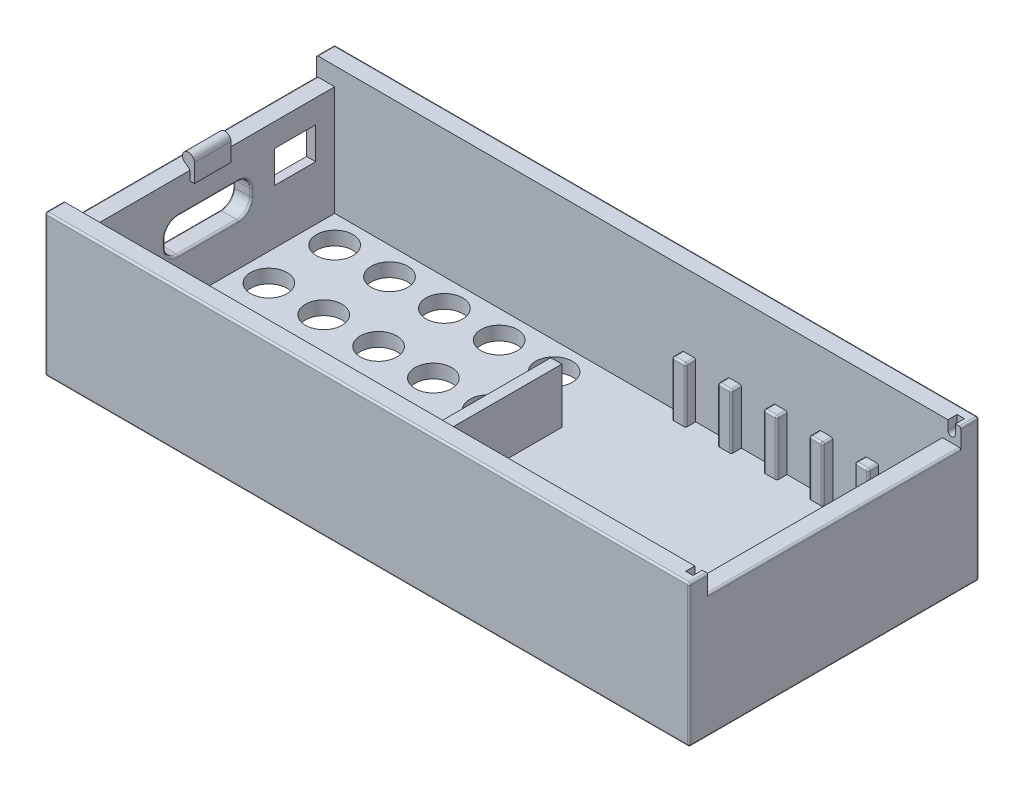
from build123d import *

# Parameters (mm, degrees)
EXTRUDE_1_DEPTH     = 31.7
SKETCH_3_W          = 66.5
SKETCH_3_H          = 2
EXTRUDE_2_DEPTH     = 12
SKETCH_4_W          = 66.5
SKETCH_4_H          = 2
EXTRUDE_3_DEPTH     = 12
SKETCH_5_W          = 1.2
SKETCH_5_H          = 12
EXTRUDE_4_DEPTH     = 6
CUT_EXTRUDE_3_REACH = 80.469
SKETCH_10_W         = 4.5
SKETCH_10_H         = 3.5
CUT_EXTRUDE_4_REACH = 80.469
SKETCH_14_W         = 1.5
SKETCH_14_H         = 6
EXTRUDE_7_DEPTH     = 1.1
FILLET_5_R          = 0.2
FILLET_6_R          = 0.2
SKETCH_15_W         = 1.5
SKETCH_15_H         = 6
EXTRUDE_8_DEPTH     = 1.1
FILLET_7_R          = 0.2
SKETCH_16_W         = 2
SKETCH_16_H         = 2
EXTRUDE_9_DEPTH     = 70.5
FILLET_8_R          = 0.2
FILLET_9_R          = 0.2
FILLET_10_R         = 0.2
FILLET_11_R         = 0.2
SKETCH_17_W         = 6.5
SKETCH_17_H         = 5.5
CUT_EXTRUDE_5_DEPTH = 1
CHAMFER_1_SIZE      = 0.5
SKETCH_18_R         = 2
CUT_EXTRUDE_6_DEPTH = 79.556603796
CUT_EXTRUDE_7_DEPTH = 1
CUT_EXTRUDE_START   = -1
CUT_EXTRUDE_8_DEPTH = 1
EXTRUDE_10_DEPTH    = 2
FILLET_13_R         = 1


with BuildPart() as part:
    # 草图1 → 凸台-拉伸1 (new body)
    with BuildSketch(Plane.XY):
        Polygon((0, 0), (70.5, 0), (70.5, 13.5), (68.5, 13.5), (68.5, 1.5), (2, 1.5), (2, 13.5), (0, 13.5), align=None)
    extrude(amount=EXTRUDE_1_DEPTH)

    # 草图3 → 凸台-拉伸2 (add, through all)
    with BuildSketch(Plane(origin=(0, 1.5, 0), x_dir=(1, 0, 0), z_dir=(0, 1, 0))):
        with Locations((35.25, -30.7)):
            Rectangle(SKETCH_3_W, SKETCH_3_H)
    extrude(amount=EXTRUDE_2_DEPTH)

    # 草图4 → 凸台-拉伸3 (add, through all)
    with BuildSketch(Plane(origin=(0, 1.5, 0), x_dir=(1, 0, 0), z_dir=(0, 1, 0))):
        with Locations((35.25, -1)):
            Rectangle(SKETCH_4_W, SKETCH_4_H)
    extrude(amount=EXTRUDE_3_DEPTH)

    # 草图5 → 凸台-拉伸4 (add)
    with BuildSketch(Plane(origin=(0, 1.5, 0), x_dir=(1, 0, 0), z_dir=(0, 1, 0))):
        with Locations((34.1, -15.85)):
            Rectangle(SKETCH_5_W, SKETCH_5_H)
    extrude(amount=EXTRUDE_4_DEPTH)

    # 草图10 → 切除-拉伸3 (cut, up to next)
    with BuildSketch(Plane.ZY, mode=Mode.PRIVATE) as cut_extrude_3_sk1:
        with Locations((6.32498095, 9.186156697)):
            Rectangle(SKETCH_10_W, SKETCH_10_H)
    cut_extrude_3_tool1 = extrude(cut_extrude_3_sk1.sketch, amount=-CUT_EXTRUDE_3_REACH, mode=Mode.PRIVATE) & part.part
    add(cut_extrude_3_tool1.solids().sort_by_distance((0, 9.186157, 6.324981))[0], mode=Mode.SUBTRACT)

    # 草图11 → 切除-拉伸4 (cut, up to next)
    with BuildSketch(Plane.ZY, mode=Mode.PRIVATE) as cut_extrude_4_sk1:
        with BuildLine():
            Line((11.129999793, 8.33615705), (11.129999793, 7.576157015))
            ThreePointArc((11.129999793, 7.576157015), (11.554694976, 6.550852144), (12.579999847, 6.126156961))
            Line((12.579999847, 6.126156961), (19.120000153, 6.126156961))
            ThreePointArc((19.120000153, 6.126156961), (20.145305024, 6.550852144), (20.570000207, 7.576157015))
            Line((20.570000207, 7.576157015), (20.570000207, 8.33615705))
            ThreePointArc((20.570000207, 8.33615705), (20.145305024, 9.361461921), (19.120000153, 9.786157104))
            Line((19.120000153, 9.786157104), (12.579999847, 9.786157104))
            ThreePointArc((12.579999847, 9.786157104), (11.554694976, 9.361461921), (11.129999793, 8.33615705))
        make_face()
    cut_extrude_4_tool1 = extrude(cut_extrude_4_sk1.sketch, amount=-CUT_EXTRUDE_4_REACH, mode=Mode.PRIVATE) & part.part
    add(cut_extrude_4_tool1.solids().sort_by_distance((0, 7.956157, 15.85))[0], mode=Mode.SUBTRACT)

    # 草图14 → 凸台-拉伸7 (add)
    with BuildSketch(Plane.XY.offset(2)):
        with Locations((65.745360324, 4.5)):
            Rectangle(SKETCH_14_W, SKETCH_14_H)
        with Locations((60.745360324, 4.5)):
            Rectangle(SKETCH_14_W, SKETCH_14_H)
        with Locations((55.745360324, 4.5)):
            Rectangle(SKETCH_14_W, SKETCH_14_H)
        with Locations((50.745360324, 4.5)):
            Rectangle(SKETCH_14_W, SKETCH_14_H)
        with Locations((45.745360324, 4.5)):
            Rectangle(SKETCH_14_W, SKETCH_14_H)
        with Locations((40.745360324, 4.5)):
            Rectangle(SKETCH_14_W, SKETCH_14_H)
    extrude(amount=EXTRUDE_7_DEPTH)

    # 圆角5
    fillet_5_edges = [part.edges().sort_by_distance(p)[0] for p in [
        (66.495360324, 4.5, 3.1),
        (65.745360324, 7.5, 3.1),
        (64.995360324, 4.5, 3.1),
        (61.495360324, 4.5, 3.1),
        (60.745360324, 7.5, 3.1),
        (59.995360324, 4.5, 3.1),
        (56.495360324, 4.5, 3.1),
        (55.745360324, 7.5, 3.1),
        (54.995360324, 4.5, 3.1),
        (51.495360324, 4.5, 3.1),
        (50.745360324, 7.5, 3.1),
        (49.995360324, 4.5, 3.1),
        (46.495360324, 4.5, 3.1),
        (45.745360324, 7.5, 3.1),
        (44.995360324, 4.5, 3.1),
        (41.495360324, 4.5, 3.1),
        (40.745360324, 7.5, 3.1),
        (39.995360324, 4.5, 3.1),
    ]]
    fillet(fillet_5_edges, radius=FILLET_5_R)

    # 圆角6
    # the kernel refuses this fillet: 0.2 mm, written as the material it takes off along each edge
    with BuildSketch(Plane(origin=(65.195360324, 7.3, 2.9), x_dir=(0, 1, 0), z_dir=(-1, 0, 0))) as fillet_6_piece_1_section:
        Polygon((0, 0), (FILLET_6_R, 0), (FILLET_6_R, -FILLET_6_R), (0, -FILLET_6_R), align=None)
    fillet_6_piece_1 = extrude(amount=FILLET_6_R, mode=Mode.PRIVATE)
    fillet_6_piece_1 = fillet_6_piece_1 - Plane(origin=(65.195360324, 7.3, 2.9), x_dir=(0, -0.7071067811865475, -0.7071067811865475), z_dir=(-1, 0, 0)) * Sphere(FILLET_6_R, mode=Mode.PRIVATE)
    add(fillet_6_piece_1, mode=Mode.SUBTRACT)
    with BuildSketch(Plane(origin=(66.295360324, 7.3, 2.9), x_dir=(0, 1, 0), z_dir=(1, 0, 0))) as fillet_6_piece_2_section:
        Polygon((0, 0), (FILLET_6_R, 0), (FILLET_6_R, FILLET_6_R), (0, FILLET_6_R), align=None)
    fillet_6_piece_2 = extrude(amount=FILLET_6_R, mode=Mode.PRIVATE)
    fillet_6_piece_2 = fillet_6_piece_2 - Plane(origin=(66.295360324, 7.3, 2.9), x_dir=(0, -0.7071067811865475, -0.7071067811865475), z_dir=(1, 0, 0)) * Sphere(FILLET_6_R, mode=Mode.PRIVATE)
    add(fillet_6_piece_2, mode=Mode.SUBTRACT)
    with BuildSketch(Plane(origin=(60.195360324, 7.3, 2.9), x_dir=(0, 1, 0), z_dir=(-1, 0, 0))) as fillet_6_piece_3_section:
        Polygon((0, 0), (FILLET_6_R, 0), (FILLET_6_R, -FILLET_6_R), (0, -FILLET_6_R), align=None)
    fillet_6_piece_3 = extrude(amount=FILLET_6_R, mode=Mode.PRIVATE)
    fillet_6_piece_3 = fillet_6_piece_3 - Plane(origin=(60.195360324, 7.3, 2.9), x_dir=(0, -0.7071067811865475, -0.7071067811865475), z_dir=(-1, 0, 0)) * Sphere(FILLET_6_R, mode=Mode.PRIVATE)
    add(fillet_6_piece_3, mode=Mode.SUBTRACT)
    with BuildSketch(Plane(origin=(61.295360324, 7.3, 2.9), x_dir=(0, 1, 0), z_dir=(1, 0, 0))) as fillet_6_piece_4_section:
        Polygon((0, 0), (FILLET_6_R, 0), (FILLET_6_R, FILLET_6_R), (0, FILLET_6_R), align=None)
    fillet_6_piece_4 = extrude(amount=FILLET_6_R, mode=Mode.PRIVATE)
    fillet_6_piece_4 = fillet_6_piece_4 - Plane(origin=(61.295360324, 7.3, 2.9), x_dir=(0, -0.7071067811865475, -0.7071067811865475), z_dir=(1, 0, 0)) * Sphere(FILLET_6_R, mode=Mode.PRIVATE)
    add(fillet_6_piece_4, mode=Mode.SUBTRACT)
    with BuildSketch(Plane(origin=(55.195360324, 7.3, 2.9), x_dir=(0, 1, 0), z_dir=(-1, 0, 0))) as fillet_6_piece_5_section:
        Polygon((0, 0), (FILLET_6_R, 0), (FILLET_6_R, -FILLET_6_R), (0, -FILLET_6_R), align=None)
    fillet_6_piece_5 = extrude(amount=FILLET_6_R, mode=Mode.PRIVATE)
    fillet_6_piece_5 = fillet_6_piece_5 - Plane(origin=(55.195360324, 7.3, 2.9), x_dir=(0, -0.7071067811865475, -0.7071067811865475), z_dir=(-1, 0, 0)) * Sphere(FILLET_6_R, mode=Mode.PRIVATE)
    add(fillet_6_piece_5, mode=Mode.SUBTRACT)
    with BuildSketch(Plane(origin=(56.295360324, 7.3, 2.9), x_dir=(0, 1, 0), z_dir=(1, 0, 0))) as fillet_6_piece_6_section:
        Polygon((0, 0), (FILLET_6_R, 0), (FILLET_6_R, FILLET_6_R), (0, FILLET_6_R), align=None)
    fillet_6_piece_6 = extrude(amount=FILLET_6_R, mode=Mode.PRIVATE)
    fillet_6_piece_6 = fillet_6_piece_6 - Plane(origin=(56.295360324, 7.3, 2.9), x_dir=(0, -0.7071067811865475, -0.7071067811865475), z_dir=(1, 0, 0)) * Sphere(FILLET_6_R, mode=Mode.PRIVATE)
    add(fillet_6_piece_6, mode=Mode.SUBTRACT)
    with BuildSketch(Plane(origin=(50.195360324, 7.3, 2.9), x_dir=(0, 1, 0), z_dir=(-1, 0, 0))) as fillet_6_piece_7_section:
        Polygon((0, 0), (FILLET_6_R, 0), (FILLET_6_R, -FILLET_6_R), (0, -FILLET_6_R), align=None)
    fillet_6_piece_7 = extrude(amount=FILLET_6_R, mode=Mode.PRIVATE)
    fillet_6_piece_7 = fillet_6_piece_7 - Plane(origin=(50.195360324, 7.3, 2.9), x_dir=(0, -0.7071067811865475, -0.7071067811865475), z_dir=(-1, 0, 0)) * Sphere(FILLET_6_R, mode=Mode.PRIVATE)
    add(fillet_6_piece_7, mode=Mode.SUBTRACT)
    with BuildSketch(Plane(origin=(51.295360324, 7.3, 2.9), x_dir=(0, 1, 0), z_dir=(1, 0, 0))) as fillet_6_piece_8_section:
        Polygon((0, 0), (FILLET_6_R, 0), (FILLET_6_R, FILLET_6_R), (0, FILLET_6_R), align=None)
    fillet_6_piece_8 = extrude(amount=FILLET_6_R, mode=Mode.PRIVATE)
    fillet_6_piece_8 = fillet_6_piece_8 - Plane(origin=(51.295360324, 7.3, 2.9), x_dir=(0, -0.7071067811865475, -0.7071067811865475), z_dir=(1, 0, 0)) * Sphere(FILLET_6_R, mode=Mode.PRIVATE)
    add(fillet_6_piece_8, mode=Mode.SUBTRACT)
    with BuildSketch(Plane(origin=(45.195360324, 7.3, 2.9), x_dir=(0, 1, 0), z_dir=(-1, 0, 0))) as fillet_6_piece_9_section:
        Polygon((0, 0), (FILLET_6_R, 0), (FILLET_6_R, -FILLET_6_R), (0, -FILLET_6_R), align=None)
    fillet_6_piece_9 = extrude(amount=FILLET_6_R, mode=Mode.PRIVATE)
    fillet_6_piece_9 = fillet_6_piece_9 - Plane(origin=(45.195360324, 7.3, 2.9), x_dir=(0, -0.7071067811865475, -0.7071067811865475), z_dir=(-1, 0, 0)) * Sphere(FILLET_6_R, mode=Mode.PRIVATE)
    add(fillet_6_piece_9, mode=Mode.SUBTRACT)
    with BuildSketch(Plane(origin=(46.295360324, 7.3, 2.9), x_dir=(0, 1, 0), z_dir=(1, 0, 0))) as fillet_6_piece_10_section:
        Polygon((0, 0), (FILLET_6_R, 0), (FILLET_6_R, FILLET_6_R), (0, FILLET_6_R), align=None)
    fillet_6_piece_10 = extrude(amount=FILLET_6_R, mode=Mode.PRIVATE)
    fillet_6_piece_10 = fillet_6_piece_10 - Plane(origin=(46.295360324, 7.3, 2.9), x_dir=(0, -0.7071067811865475, -0.7071067811865475), z_dir=(1, 0, 0)) * Sphere(FILLET_6_R, mode=Mode.PRIVATE)
    add(fillet_6_piece_10, mode=Mode.SUBTRACT)
    with BuildSketch(Plane(origin=(40.195360324, 7.3, 2.9), x_dir=(0, 1, 0), z_dir=(-1, 0, 0))) as fillet_6_piece_11_section:
        Polygon((0, 0), (FILLET_6_R, 0), (FILLET_6_R, -FILLET_6_R), (0, -FILLET_6_R), align=None)
    fillet_6_piece_11 = extrude(amount=FILLET_6_R, mode=Mode.PRIVATE)
    fillet_6_piece_11 = fillet_6_piece_11 - Plane(origin=(40.195360324, 7.3, 2.9), x_dir=(0, -0.7071067811865475, -0.7071067811865475), z_dir=(-1, 0, 0)) * Sphere(FILLET_6_R, mode=Mode.PRIVATE)
    add(fillet_6_piece_11, mode=Mode.SUBTRACT)
    with BuildSketch(Plane(origin=(41.295360324, 7.3, 2.9), x_dir=(0, 1, 0), z_dir=(1, 0, 0))) as fillet_6_piece_12_section:
        Polygon((0, 0), (FILLET_6_R, 0), (FILLET_6_R, FILLET_6_R), (0, FILLET_6_R), align=None)
    fillet_6_piece_12 = extrude(amount=FILLET_6_R, mode=Mode.PRIVATE)
    fillet_6_piece_12 = fillet_6_piece_12 - Plane(origin=(41.295360324, 7.3, 2.9), x_dir=(0, -0.7071067811865475, -0.7071067811865475), z_dir=(1, 0, 0)) * Sphere(FILLET_6_R, mode=Mode.PRIVATE)
    add(fillet_6_piece_12, mode=Mode.SUBTRACT)
    with BuildSketch(Plane(origin=(66.495360324, 7.5, 2), x_dir=(0, -1, 0), z_dir=(0, 0, 1)), Plane(origin=(61.495360324, 7.5, 2), x_dir=(0, -1, 0), z_dir=(0, 0, 1)), Plane(origin=(56.495360324, 7.5, 2), x_dir=(0, -1, 0), z_dir=(0, 0, 1)), Plane(origin=(51.495360324, 7.5, 2), x_dir=(0, -1, 0), z_dir=(0, 0, 1)), Plane(origin=(46.495360324, 7.5, 2), x_dir=(0, -1, 0), z_dir=(0, 0, 1)), Plane(origin=(41.495360324, 7.5, 2), x_dir=(0, -1, 0), z_dir=(0, 0, 1))) as fillet_6_piece_13:
        with BuildLine():
            CenterArc((FILLET_6_R, -FILLET_6_R), FILLET_6_R, 90, 90)
            Line((0, -FILLET_6_R), (0, 0))
            Line((0, 0), (FILLET_6_R, 0))
        make_face()
    extrude(amount=0.9, mode=Mode.SUBTRACT)
    with BuildSketch(Plane(origin=(64.995360324, 7.5, 2), x_dir=(0, -1, 0), z_dir=(0, 0, 1)), Plane(origin=(59.995360324, 7.5, 2), x_dir=(0, -1, 0), z_dir=(0, 0, 1)), Plane(origin=(54.995360324, 7.5, 2), x_dir=(0, -1, 0), z_dir=(0, 0, 1)), Plane(origin=(49.995360324, 7.5, 2), x_dir=(0, -1, 0), z_dir=(0, 0, 1)), Plane(origin=(44.995360324, 7.5, 2), x_dir=(0, -1, 0), z_dir=(0, 0, 1)), Plane(origin=(39.995360324, 7.5, 2), x_dir=(0, -1, 0), z_dir=(0, 0, 1))) as fillet_6_piece_14:
        with BuildLine():
            CenterArc((FILLET_6_R, FILLET_6_R), FILLET_6_R, 180, 90)
            Line((0, FILLET_6_R), (0, 0))
            Line((0, 0), (FILLET_6_R, 0))
        make_face()
    extrude(amount=0.9, mode=Mode.SUBTRACT)

    # 草图15 → 凸台-拉伸8 (add)
    with BuildSketch(Plane(origin=(0, 0, 29.7), x_dir=(-1, 0, 0), z_dir=(0, 0, -1))):
        with Locations((-65.75, 4.5)):
            Rectangle(SKETCH_15_W, SKETCH_15_H)
        with Locations((-60.75, 4.5)):
            Rectangle(SKETCH_15_W, SKETCH_15_H)
        with Locations((-55.75, 4.5)):
            Rectangle(SKETCH_15_W, SKETCH_15_H)
        with Locations((-50.75, 4.5)):
            Rectangle(SKETCH_15_W, SKETCH_15_H)
        with Locations((-45.75, 4.5)):
            Rectangle(SKETCH_15_W, SKETCH_15_H)
        with Locations((-40.75, 4.5)):
            Rectangle(SKETCH_15_W, SKETCH_15_H)
    extrude(amount=EXTRUDE_8_DEPTH)

    # 圆角7
    fillet_7_edges = [part.edges().sort_by_distance(p)[0] for p in [
        (66.5, 7.5, 29.15),
        (65, 7.5, 29.15),
        (66.5, 4.5, 28.6),
        (65, 4.5, 28.6),
        (65.75, 7.5, 28.6),
        (60, 7.5, 29.15),
        (61.5, 7.5, 29.15),
        (60, 4.5, 28.6),
        (60.75, 7.5, 28.6),
        (61.5, 4.5, 28.6),
        (55, 7.5, 29.15),
        (56.5, 7.5, 29.15),
        (55, 4.5, 28.6),
        (55.75, 7.5, 28.6),
        (56.5, 4.5, 28.6),
        (50, 7.5, 29.15),
        (51.5, 7.5, 29.15),
        (50, 4.5, 28.6),
        (50.75, 7.5, 28.6),
        (51.5, 4.5, 28.6),
        (45, 7.5, 29.15),
        (46.5, 7.5, 29.15),
        (45, 4.5, 28.6),
        (45.75, 7.5, 28.6),
        (46.5, 4.5, 28.6),
        (40, 7.5, 29.15),
        (41.5, 7.5, 29.15),
        (40, 4.5, 28.6),
        (40.75, 7.5, 28.6),
        (41.5, 4.5, 28.6),
    ]]
    fillet(fillet_7_edges, radius=FILLET_7_R)

    # 草图16 → 凸台-拉伸9 (add, through all)
    with BuildSketch(Plane.ZY):
        with Locations((1, 14.5)):
            Rectangle(SKETCH_16_W, SKETCH_16_H)
        with Locations((30.7, 14.5)):
            Rectangle(SKETCH_16_W, SKETCH_16_H)
    extrude(amount=-EXTRUDE_9_DEPTH)

    # 圆角8
    fillet_8_edges = [part.edges().sort_by_distance(p)[0] for p in [
        (0, 9.361461921, 11.554694976),
        (0, 7.956157032, 11.129999793),
        (0, 6.550852144, 11.554694976),
        (0, 6.126156961, 15.85),
        (0, 6.550852144, 20.145305024),
        (0, 7.956157032, 20.570000207),
        (0, 9.361461921, 20.145305024),
        (0, 9.786157104, 15.85),
    ]]
    fillet(fillet_8_edges, radius=FILLET_8_R)

    # 圆角9
    fillet_9_edges = [part.edges().sort_by_distance(p)[0] for p in [
        (35.25, 15.5, 0),
        (70.5, 13.5, 15.85),
        (0, 13.5, 15.85),
        (35.25, 15.5, 31.7),
    ]]
    fillet(fillet_9_edges, radius=FILLET_9_R)

    # 圆角10
    fillet_10_edges = [part.edges().sort_by_distance(p)[0] for p in [
        (70.5, 7.65, 0),
        (35.25, 0, 0),
        (70.5, 7.65, 31.7),
        (70.5, 0, 15.85),
        (0, 0, 15.85),
        (70.5, 15.5, 1.1),
        (0, 15.5, 1.1),
        (70.5, 15.5, 30.6),
        (70.5, 15.441421356, 31.641421356),
        (70.5, 15.441421356, 0.058578644),
        (0, 7.65, 0),
        (0, 7.65, 31.7),
        (0, 15.5, 30.6),
        (0, 15.441421356, 31.641421356),
        (0, 15.441421356, 0.058578644),
        (35.25, 0, 31.7),
    ]]
    fillet(fillet_10_edges, radius=FILLET_10_R)

    # 圆角11
    fillet_11_edges = [part.edges().sort_by_distance(p)[0] for p in [
        (2, 7.956157032, 11.129999793),
        (2, 9.361461921, 11.554694976),
        (2, 9.786157104, 15.85),
        (2, 9.361461921, 20.145305024),
        (2, 7.956157032, 20.570000207),
        (2, 6.550852144, 20.145305024),
        (2, 6.126156961, 15.85),
        (2, 6.550852144, 11.554694976),
    ]]
    fillet(fillet_11_edges, radius=FILLET_11_R)

    # 草图17 → 切除-拉伸5 (cut)
    with BuildSketch(Plane.ZY):
        with Locations((6.32498095, 9.186156697)):
            Rectangle(SKETCH_17_W, SKETCH_17_H)
    extrude(amount=-CUT_EXTRUDE_5_DEPTH, mode=Mode.SUBTRACT)

    # 倒角1
    chamfer_1_edges = [part.edges().sort_by_distance(p)[0] for p in [
        (0, 6.436156697, 6.32498095),
        (0, 9.186156697, 9.57498095),
        (0, 11.936156697, 6.32498095),
        (0, 9.186156697, 3.07498095),
    ]]
    chamfer(chamfer_1_edges, length=CHAMFER_1_SIZE)

    # 草图18 → 切除-拉伸6 (cut, through all)
    with BuildSketch(Plane(origin=(0, 1.5, 0), x_dir=(1, 0, 0), z_dir=(0, 1, 0))):
        with Locations(Location((11, -26.6, 0), (0, 0, 180))):
            Circle(SKETCH_18_R)
        with Locations(Location((11, -19.4, 0), (0, 0, 180))):
            Circle(SKETCH_18_R)
        with Locations(Location((5, -26.6, 0), (0, 0, 180))):
            Circle(SKETCH_18_R)
        with Locations(Location((5, -19.4, 0), (0, 0, 180))):
            Circle(SKETCH_18_R)
        with Locations(Location((17, -19.4, 0), (0, 0, 180))):
            Circle(SKETCH_18_R)
        with Locations(Location((23, -19.4, 0), (0, 0, 180))):
            Circle(SKETCH_18_R)
        with Locations(Location((29, -19.4, 0), (0, 0, 180))):
            Circle(SKETCH_18_R)
        with Locations(Location((17, -26.6, 0), (0, 0, 180))):
            Circle(SKETCH_18_R)
        with Locations(Location((23, -26.6, 0), (0, 0, 180))):
            Circle(SKETCH_18_R)
        with Locations(Location((29, -26.6, 0), (0, 0, 180))):
            Circle(SKETCH_18_R)
        with Locations(Location((29, -12.2, 0), (0, 0, 180))):
            Circle(SKETCH_18_R)
        with Locations(Location((23, -12.2, 0), (0, 0, 180))):
            Circle(SKETCH_18_R)
        with Locations(Location((17, -12.2, 0), (0, 0, 180))):
            Circle(SKETCH_18_R)
        with Locations(Location((11, -12.2, 0), (0, 0, 180))):
            Circle(SKETCH_18_R)
        with Locations(Location((5, -12.2, 0), (0, 0, 180))):
            Circle(SKETCH_18_R)
        with Locations(Location((5, -5, 0), (0, 0, 180))):
            Circle(SKETCH_18_R)
        with Locations(Location((11, -5, 0), (0, 0, 180))):
            Circle(SKETCH_18_R)
        with Locations(Location((17, -5, 0), (0, 0, 180))):
            Circle(SKETCH_18_R)
        with Locations(Location((23, -5, 0), (0, 0, 180))):
            Circle(SKETCH_18_R)
        with Locations(Location((29, -5, 0), (0, 0, 180))):
            Circle(SKETCH_18_R)
    extrude(amount=-CUT_EXTRUDE_6_DEPTH, mode=Mode.SUBTRACT)

    # 草图19 → 切除-拉伸7 (cut)
    with BuildSketch(Plane.XY.offset(2)):
        with BuildLine():
            Line((69.9, 14.5), (69.9, 15.5))
            Line((69.9, 15.5), (69.1, 15.5))
            Line((69.1, 15.5), (69.1, 14.5))
            ThreePointArc((69.1, 14.5), (69.5, 14.1), (69.9, 14.5))
        make_face()
    extrude(amount=-CUT_EXTRUDE_7_DEPTH, mode=Mode.SUBTRACT)

    # 草图20 → 切除-拉伸8 (cut)
    with BuildSketch(Plane(origin=(0, 0, 29.7), x_dir=(-1, 0, 0), z_dir=(0, 0, -1)).offset(CUT_EXTRUDE_START)):
        with BuildLine():
            Line((-69.9, 14.5), (-69.9, 15.5))
            Line((-69.9, 15.5), (-69.1, 15.5))
            Line((-69.1, 15.5), (-69.1, 14.5))
            ThreePointArc((-69.1, 14.5), (-69.5, 14.1), (-69.9, 14.5))
        make_face()
    extrude(amount=CUT_EXTRUDE_8_DEPTH, mode=Mode.SUBTRACT)

    # 草图22 → 凸台-拉伸10 (add, symmetric)
    with BuildSketch(Plane(origin=(0, 0, 15.85), x_dir=(-1, 0, 0), z_dir=(0, 0, -1))):
        with BuildLine():
            Line((-2, 12.5), (-2.5, 12.5))
            Line((-2.5, 12.5), (-2.5, 14.5))
            ThreePointArc((-2.5, 14.5), (-1.340098049, 14.903112887), (-2, 13.867544468))
            Line((-2, 13.867544468), (-2, 13.5))
            Line((-2, 13.5), (-2, 12.5))
        make_face()
    extrude(amount=EXTRUDE_10_DEPTH, both=True)

    # 圆角13
    # the kernel refuses this fillet: 1 mm, written as the material it adds along each edge
    with BuildSketch(Plane(origin=(2, 13.867544468, 17.85), x_dir=(0, -1, 0), z_dir=(0, 0, -1))) as fillet_13_piece_1:
        with BuildLine():
            CenterArc((0.8490139, 0.876462883), FILLET_13_R, 206.121781757, 35.096801228)
            Line((-0.048846362, 0.436182348), (-0.066803567, 0.427376737))
            ThreePointArc((-0.066803567, 0.427376737), (-0.00636914, 0.220112976), (-0.01946017, 0.004615385))
            Line((-0.01946017, 0.004615385), (0, -0.02))
            ThreePointArc((0, -0.02), (0.183772234, -0.02), (0.357915079, -0.017529258))
            Line((0.357915079, -0.017529258), (0.367544468, 0))
        make_face()
    extrude(amount=4)


solid = part.part
